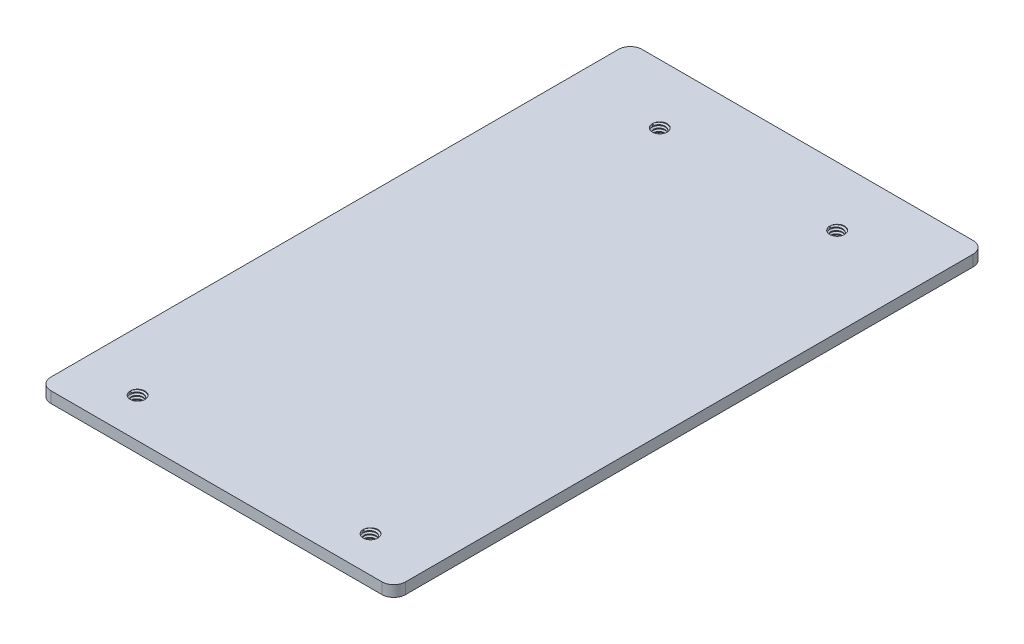
from build123d import *

# Parameters (mm, degrees)
SKETCH1_W           = 152.4
SKETCH1_H           = 254
BOSS_EXTRUDE1_DEPTH = 4.7625
FILLET2_R           = 5.08
FILLET3_R           = 5.08
SKETCH9_R           = 3.175
CUT_EXTRUDE1_DEPTH  = 297.25064
THREAD1_PITCH       = 1.27
THREAD2_PITCH       = 1.27
THREAD3_PITCH       = 1.27
THREAD4_PITCH       = 1.27


with BuildPart() as part:
    # Sketch1 → Boss-Extrude1 (new body)
    with BuildSketch(Plane(origin=(0, 0, 0), x_dir=(1, 0, 0), z_dir=(0, 1, 0))):
        with Locations((76.2, -127)):
            Rectangle(SKETCH1_W, SKETCH1_H)
    extrude(amount=BOSS_EXTRUDE1_DEPTH)

    # Fillet2
    fillet2_edges = [part.edges().sort_by_distance(p)[0] for p in [
        (152.4, 2.38125, 0),
    ]]
    fillet(fillet2_edges, radius=FILLET2_R)

    # Fillet3
    fillet3_edges = [part.edges().sort_by_distance(p)[0] for p in [
        (0, 2.38125, 0),
        (152.4, 2.38125, 254),
        (0, 2.38125, 254),
    ]]
    fillet(fillet3_edges, radius=FILLET3_R)

    # Sketch9 → Cut-Extrude1 (cut, through all)
    with BuildSketch(Plane(origin=(0, 4.7625, 0), x_dir=(1, 0, 0), z_dir=(0, 1, 0))):
        with Locations(Location((114.3, -25.4, 0), (0, 0, 270))):
            Circle(SKETCH9_R)
        with Locations(Location((38.1, -25.4, 0), (0, 0, 270))):
            Circle(SKETCH9_R)
        with Locations(Location((127, -238.566594, 0), (0, 0, 270))):
            Circle(SKETCH9_R)
        with Locations(Location((25.4, -237.04585, 0), (0, 0, 270))):
            Circle(SKETCH9_R)
    extrude(amount=-CUT_EXTRUDE1_DEPTH, mode=Mode.SUBTRACT)

    # Thread1: the profile of Thread Profile2 profile screwed along a right-hand helix of 3.1 turns, 8 arcs to a turn; built about Z, then put on its axis
    thread1_z = Axis((0, 0, 0), (0, 0, 1))
    thread1_corners = [(3.1753, 0, -0.000173), (3.1753, 0, 1.111423), (2.487592, 0, 0.714375), (2.487592, 0, 0.396875)]
    with BuildLine(mode=Mode.PRIVATE) as thread1_profile:
        Line(thread1_corners[0], thread1_corners[1])
        Line(thread1_corners[1], thread1_corners[2])
        Line(thread1_corners[2], thread1_corners[3])
        Line(thread1_corners[3], thread1_corners[0])
    thread1_cap = Face(thread1_profile.wire())
    thread1_turn_angles = [0, 22.5, 45, 67.5, 90, 112.5, 135, 157.5, 180, 202.5, 225, 247.5, 270, 292.5, 315, 337.5, 360]
    thread1_turn_weights = [1, 0.9238795325112867, 1, 0.9238795325112867, 1, 0.9238795325112867, 1, 0.9238795325112867, 1, 0.9238795325112867, 1, 0.9238795325112867, 1, 0.9238795325112867, 1, 0.9238795325112867, 1]
    thread1_turn_rails = [Edge.make_bspline([Vector(p[0], p[1], 0).rotate(thread1_z, thread1_turn_angles[k]) / thread1_turn_weights[k] + Vector(0, 0, p[2] + THREAD1_PITCH * thread1_turn_angles[k] / 360) for k in range(17)], [0, 0, 0, 1, 1, 2, 2, 3, 3, 4, 4, 5, 5, 6, 6, 7, 7, 8, 8, 8], 2, thread1_turn_weights) for p in thread1_corners]
    thread1_turn_sides = [Face.make_surface_from_curves(thread1_turn_rails[p[0]], thread1_turn_rails[p[1]]) for p in [(0, 1), (1, 2), (2, 3), (3, 0)]]
    thread1_last_angles = [1080, 1098, 1116]
    thread1_last_weights = [1, 0.9510565162951535, 1]
    thread1_last_rails = [Edge.make_bspline([Vector(p[0], p[1], 0).rotate(thread1_z, thread1_last_angles[k]) / thread1_last_weights[k] + Vector(0, 0, p[2] + THREAD1_PITCH * thread1_last_angles[k] / 360) for k in range(3)], [0, 0, 0, 1, 1, 1], 2, thread1_last_weights) for p in thread1_corners]
    thread1_last_sides = [Face.make_surface_from_curves(thread1_last_rails[p[0]], thread1_last_rails[p[1]]) for p in [(0, 1), (1, 2), (2, 3), (3, 0)]]
    thread1 = Plane(origin=(25.4, 4.7625, 237.04585), x_dir=(-1, 0, 0), z_dir=(0, -1, 0)) * Solid(Shell([*[p.moved(Location((0, 0, THREAD1_PITCH * i))) for i in range(3) for p in thread1_turn_sides], *thread1_last_sides, thread1_cap, thread1_cap.rotate(thread1_z, 1116).moved(Location((0, 0, THREAD1_PITCH * 1116 / 360)))]))
    add(thread1)

    # Thread2: the profile of Thread Profile3 profile screwed along a right-hand helix of 3.1 turns, 8 arcs to a turn; built about Z, then put on its axis
    thread2_z = Axis((0, 0, 0), (0, 0, 1))
    thread2_corners = [(3.1753, 0, -0.000173), (3.1753, 0, 1.111423), (2.487592, 0, 0.714375), (2.487592, 0, 0.396875)]
    with BuildLine(mode=Mode.PRIVATE) as thread2_profile:
        Line(thread2_corners[0], thread2_corners[1])
        Line(thread2_corners[1], thread2_corners[2])
        Line(thread2_corners[2], thread2_corners[3])
        Line(thread2_corners[3], thread2_corners[0])
    thread2_cap = Face(thread2_profile.wire())
    thread2_turn_angles = [0, 22.5, 45, 67.5, 90, 112.5, 135, 157.5, 180, 202.5, 225, 247.5, 270, 292.5, 315, 337.5, 360]
    thread2_turn_weights = [1, 0.9238795325112867, 1, 0.9238795325112867, 1, 0.9238795325112867, 1, 0.9238795325112867, 1, 0.9238795325112867, 1, 0.9238795325112867, 1, 0.9238795325112867, 1, 0.9238795325112867, 1]
    thread2_turn_rails = [Edge.make_bspline([Vector(p[0], p[1], 0).rotate(thread2_z, thread2_turn_angles[k]) / thread2_turn_weights[k] + Vector(0, 0, p[2] + THREAD2_PITCH * thread2_turn_angles[k] / 360) for k in range(17)], [0, 0, 0, 1, 1, 2, 2, 3, 3, 4, 4, 5, 5, 6, 6, 7, 7, 8, 8, 8], 2, thread2_turn_weights) for p in thread2_corners]
    thread2_turn_sides = [Face.make_surface_from_curves(thread2_turn_rails[p[0]], thread2_turn_rails[p[1]]) for p in [(0, 1), (1, 2), (2, 3), (3, 0)]]
    thread2_last_angles = [1080, 1098, 1116]
    thread2_last_weights = [1, 0.9510565162951535, 1]
    thread2_last_rails = [Edge.make_bspline([Vector(p[0], p[1], 0).rotate(thread2_z, thread2_last_angles[k]) / thread2_last_weights[k] + Vector(0, 0, p[2] + THREAD2_PITCH * thread2_last_angles[k] / 360) for k in range(3)], [0, 0, 0, 1, 1, 1], 2, thread2_last_weights) for p in thread2_corners]
    thread2_last_sides = [Face.make_surface_from_curves(thread2_last_rails[p[0]], thread2_last_rails[p[1]]) for p in [(0, 1), (1, 2), (2, 3), (3, 0)]]
    thread2 = Plane(origin=(38.1, 4.7625, 25.4), x_dir=(-1, 0, 0), z_dir=(0, -1, 0)) * Solid(Shell([*[p.moved(Location((0, 0, THREAD2_PITCH * i))) for i in range(3) for p in thread2_turn_sides], *thread2_last_sides, thread2_cap, thread2_cap.rotate(thread2_z, 1116).moved(Location((0, 0, THREAD2_PITCH * 1116 / 360)))]))
    add(thread2)

    # Thread3: the profile of Thread Profile4 profile screwed along a right-hand helix of 3.1 turns, 8 arcs to a turn; built about Z, then put on its axis
    thread3_z = Axis((0, 0, 0), (0, 0, 1))
    thread3_corners = [(3.1753, 0, -0.000173), (3.1753, 0, 1.111423), (2.487592, 0, 0.714375), (2.487592, 0, 0.396875)]
    with BuildLine(mode=Mode.PRIVATE) as thread3_profile:
        Line(thread3_corners[0], thread3_corners[1])
        Line(thread3_corners[1], thread3_corners[2])
        Line(thread3_corners[2], thread3_corners[3])
        Line(thread3_corners[3], thread3_corners[0])
    thread3_cap = Face(thread3_profile.wire())
    thread3_turn_angles = [0, 22.5, 45, 67.5, 90, 112.5, 135, 157.5, 180, 202.5, 225, 247.5, 270, 292.5, 315, 337.5, 360]
    thread3_turn_weights = [1, 0.9238795325112867, 1, 0.9238795325112867, 1, 0.9238795325112867, 1, 0.9238795325112867, 1, 0.9238795325112867, 1, 0.9238795325112867, 1, 0.9238795325112867, 1, 0.9238795325112867, 1]
    thread3_turn_rails = [Edge.make_bspline([Vector(p[0], p[1], 0).rotate(thread3_z, thread3_turn_angles[k]) / thread3_turn_weights[k] + Vector(0, 0, p[2] + THREAD3_PITCH * thread3_turn_angles[k] / 360) for k in range(17)], [0, 0, 0, 1, 1, 2, 2, 3, 3, 4, 4, 5, 5, 6, 6, 7, 7, 8, 8, 8], 2, thread3_turn_weights) for p in thread3_corners]
    thread3_turn_sides = [Face.make_surface_from_curves(thread3_turn_rails[p[0]], thread3_turn_rails[p[1]]) for p in [(0, 1), (1, 2), (2, 3), (3, 0)]]
    thread3_last_angles = [1080, 1098, 1116]
    thread3_last_weights = [1, 0.9510565162951535, 1]
    thread3_last_rails = [Edge.make_bspline([Vector(p[0], p[1], 0).rotate(thread3_z, thread3_last_angles[k]) / thread3_last_weights[k] + Vector(0, 0, p[2] + THREAD3_PITCH * thread3_last_angles[k] / 360) for k in range(3)], [0, 0, 0, 1, 1, 1], 2, thread3_last_weights) for p in thread3_corners]
    thread3_last_sides = [Face.make_surface_from_curves(thread3_last_rails[p[0]], thread3_last_rails[p[1]]) for p in [(0, 1), (1, 2), (2, 3), (3, 0)]]
    thread3 = Plane(origin=(114.3, 4.7625, 25.4), x_dir=(-1, 0, 0), z_dir=(0, -1, 0)) * Solid(Shell([*[p.moved(Location((0, 0, THREAD3_PITCH * i))) for i in range(3) for p in thread3_turn_sides], *thread3_last_sides, thread3_cap, thread3_cap.rotate(thread3_z, 1116).moved(Location((0, 0, THREAD3_PITCH * 1116 / 360)))]))
    add(thread3)

    # Thread4: the profile of Thread Profile5 profile screwed along a right-hand helix of 3.1 turns, 8 arcs to a turn; built about Z, then put on its axis
    thread4_z = Axis((0, 0, 0), (0, 0, 1))
    thread4_corners = [(3.1753, 0, -0.000173), (3.1753, 0, 1.111423), (2.487592, 0, 0.714375), (2.487592, 0, 0.396875)]
    with BuildLine(mode=Mode.PRIVATE) as thread4_profile:
        Line(thread4_corners[0], thread4_corners[1])
        Line(thread4_corners[1], thread4_corners[2])
        Line(thread4_corners[2], thread4_corners[3])
        Line(thread4_corners[3], thread4_corners[0])
    thread4_cap = Face(thread4_profile.wire())
    thread4_turn_angles = [0, 22.5, 45, 67.5, 90, 112.5, 135, 157.5, 180, 202.5, 225, 247.5, 270, 292.5, 315, 337.5, 360]
    thread4_turn_weights = [1, 0.9238795325112867, 1, 0.9238795325112867, 1, 0.9238795325112867, 1, 0.9238795325112867, 1, 0.9238795325112867, 1, 0.9238795325112867, 1, 0.9238795325112867, 1, 0.9238795325112867, 1]
    thread4_turn_rails = [Edge.make_bspline([Vector(p[0], p[1], 0).rotate(thread4_z, thread4_turn_angles[k]) / thread4_turn_weights[k] + Vector(0, 0, p[2] + THREAD4_PITCH * thread4_turn_angles[k] / 360) for k in range(17)], [0, 0, 0, 1, 1, 2, 2, 3, 3, 4, 4, 5, 5, 6, 6, 7, 7, 8, 8, 8], 2, thread4_turn_weights) for p in thread4_corners]
    thread4_turn_sides = [Face.make_surface_from_curves(thread4_turn_rails[p[0]], thread4_turn_rails[p[1]]) for p in [(0, 1), (1, 2), (2, 3), (3, 0)]]
    thread4_last_angles = [1080, 1098, 1116]
    thread4_last_weights = [1, 0.9510565162951535, 1]
    thread4_last_rails = [Edge.make_bspline([Vector(p[0], p[1], 0).rotate(thread4_z, thread4_last_angles[k]) / thread4_last_weights[k] + Vector(0, 0, p[2] + THREAD4_PITCH * thread4_last_angles[k] / 360) for k in range(3)], [0, 0, 0, 1, 1, 1], 2, thread4_last_weights) for p in thread4_corners]
    thread4_last_sides = [Face.make_surface_from_curves(thread4_last_rails[p[0]], thread4_last_rails[p[1]]) for p in [(0, 1), (1, 2), (2, 3), (3, 0)]]
    thread4 = Plane(origin=(127, 4.7625, 238.566594), x_dir=(-1, 0, 0), z_dir=(0, -1, 0)) * Solid(Shell([*[p.moved(Location((0, 0, THREAD4_PITCH * i))) for i in range(3) for p in thread4_turn_sides], *thread4_last_sides, thread4_cap, thread4_cap.rotate(thread4_z, 1116).moved(Location((0, 0, THREAD4_PITCH * 1116 / 360)))]))
    add(thread4)


solid = part.part
